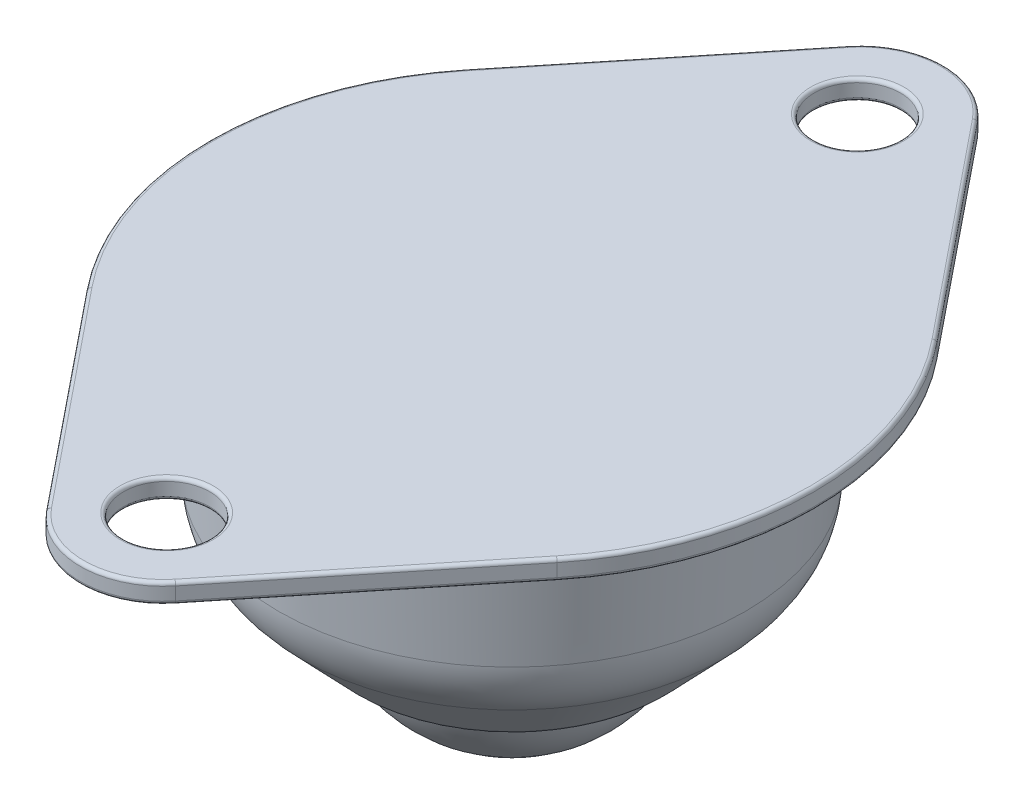
from build123d import *

# Parameters (mm, degrees)
FILLET1_R      = 1
FILLET2_R      = 5
SKETCH2_W      = 78.419719427
SKETCH2_H      = 65.605538268
EXTRUDE1_DEPTH = 10
SKETCH3_R      = 2.5
EXTRUDE2_DEPTH = 10
FILLET3_R      = 0.2


with BuildPart() as part:
    # Sketch1 → Revolve1 (revolve)
    with BuildSketch(Plane.XY):
        with BuildLine():
            Line((0, 0), (26, 0))
            Line((26, 0), (26, -1.15))
            Line((26, -1.15), (14, -1.15))
            Line((14, -1.15), (13.4, -10))
            Line((13.4, -10), (8.599342077, -15))
            Line((8.599342077, -15), (7.599342077, -15))
            ThreePointArc((7.599342077, -15), (5.463720205, -18.343608605), (1.984313483, -20.25))
            Line((1.984313483, -20.25), (0, -20.25))
            Line((0, -20.25), (0, 0))
        make_face()
    revolve(axis=Axis((0, -20.25, 0), (0, 1, 0)))

    # Fillet1
    fillet1_edges = [part.edges().sort_by_distance(p)[0] for p in [
        (-14, -1.15, 0),
        (-8.599342077, -15, 0),
    ]]
    fillet(fillet1_edges, radius=FILLET1_R)

    # Fillet2
    fillet2_edges = [part.edges().sort_by_distance(p)[0] for p in [
        (-13.4, -10, 0),
    ]]
    fillet(fillet2_edges, radius=FILLET2_R)

    # Sketch2 → Extrude1 (cut)
    with BuildSketch(Plane(origin=(0, 0, 0), x_dir=(-1, 0, 0), z_dir=(0, 1, 0))):
        with Locations((-0.942236515, -0.511843557)):
            Rectangle(SKETCH2_W, SKETCH2_H)
        with BuildLine():
            Line((3.732660136, -23.217821782), (13.608656746, -11.002475248))
            ThreePointArc((13.608656746, -11.002475248), (17.5, 0), (13.608656746, 11.002475248))
            Line((13.608656746, 11.002475248), (3.732660136, 23.217821782))
            ThreePointArc((3.732660136, 23.217821782), (0, 25), (-3.732660136, 23.217821782))
            Line((-3.732660136, 23.217821782), (-13.608656746, 11.002475248))
            ThreePointArc((-13.608656746, 11.002475248), (-17.5, 0), (-13.608656746, -11.002475248))
            Line((-13.608656746, -11.002475248), (-3.732660136, -23.217821782))
            ThreePointArc((-3.732660136, -23.217821782), (0, -25), (3.732660136, -23.217821782))
        make_face(mode=Mode.SUBTRACT)
    extrude(amount=-EXTRUDE1_DEPTH, mode=Mode.SUBTRACT)

    # Sketch3 → Extrude2 (cut)
    with BuildSketch(Plane(origin=(0, 0, 0), x_dir=(1, 0, 0), z_dir=(0, 1, 0))):
        with Locations((0, 20)):
            Circle(SKETCH3_R)
        with Locations((0, -20)):
            Circle(SKETCH3_R)
    extrude(amount=-EXTRUDE2_DEPTH, mode=Mode.SUBTRACT)

    # Fillet3
    fillet3_edges = [part.edges().sort_by_distance(p)[0] for p in [
        (8.670658441, -1.15, 17.110148515),
        (17.5, -1.15, 0),
        (8.670658441, -1.15, -17.110148515),
        (-2.5, 0, 20),
        (-2.5, -1.15, 20),
        (-2.5, 0, -20),
        (-2.5, -1.15, -20),
        (17.5, 0, 0),
        (8.670658441, 0, -17.110148515),
        (0, 0, -25),
        (-8.670658441, 0, -17.110148515),
        (-17.5, 0, 0),
        (-8.670658441, 0, 17.110148515),
        (0, 0, 25),
        (8.670658441, 0, 17.110148515),
        (0, -1.15, -25),
        (-8.670658441, -1.15, -17.110148515),
        (-17.5, -1.15, 0),
        (-8.670658441, -1.15, 17.110148515),
        (0, -1.15, 25),
    ]]
    fillet(fillet3_edges, radius=FILLET3_R)


solid = part.part
